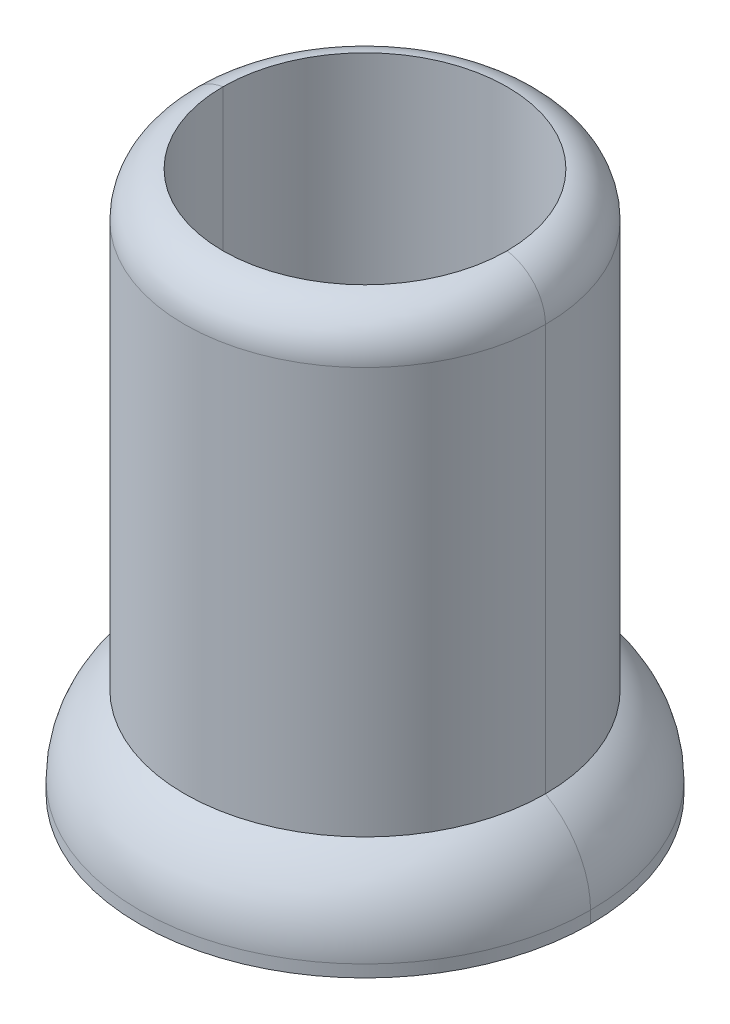
from build123d import *

# Parameters (mm, degrees)
SKETCH1_R              = 4
BOSS_EXTRUDE1_DEPTH    = 10
SKETCH6_R              = 5
BOSS_EXTRUDE2_DEPTH    = 2
SKETCH8_R              = 3.15
CUT_EXTRUDE2_DEPTH     = 14.928388277
FILLET1_R              = 2
FILLET2_R              = 1
SPLIT2_SURFACE_1_BACK  = 19.547
SPLIT2_SURFACE_1_DEPTH = 39.094
SPLIT2_SURFACE_2_BACK  = 19.547
SPLIT2_SURFACE_2_DEPTH = 39.094


with BuildPart() as part:
    # Sketch1 → Boss-Extrude1 (new body)
    with BuildSketch(Plane(origin=(0, 0, 0), x_dir=(1, 0, 0), z_dir=(0, 1, 0))):
        with Locations(Location((0, 0, 0), (0, 0, 270))):
            Circle(SKETCH1_R)
    extrude(amount=BOSS_EXTRUDE1_DEPTH)

    # Sketch6 → Boss-Extrude2 (add)
    with BuildSketch(Plane.XZ):
        with Locations(Location((0, 0, 0), (0, 0, 270))):
            Circle(SKETCH6_R)
    extrude(amount=BOSS_EXTRUDE2_DEPTH)

    # Sketch8 → Cut-Extrude2 (cut, through all)
    with BuildSketch(Plane(origin=(0, 10, 0), x_dir=(1, 0, 0), z_dir=(0, 1, 0))):
        with Locations(Location((0, 0, 0), (0, 0, 270))):
            Circle(SKETCH8_R)
    extrude(amount=-CUT_EXTRUDE2_DEPTH, mode=Mode.SUBTRACT)

    # Fillet1
    # the kernel refuses this fillet: 2 mm, written as the material it takes off along each edge
    with BuildSketch(Plane(origin=(0, 0, 0), x_dir=(0, 0, -1), z_dir=(-1, 0, 0))) as fillet1_piece_1:
        with BuildLine():
            CenterArc((3, 1.732050808), FILLET1_R, 300, 60)
            Line((4, 0), (4.02, -0.034641016))
            ThreePointArc((4.02, -0.034641016), (4.5, -0.04), (5, -0.04))
            Line((5, -0.04), (5.04, 0))
            Line((5.04, 0), (5.04, 1.732050808))
            Line((5.04, 1.732050808), (5, 1.732050808))
        make_face()
    revolve(axis=Axis((0, 0, 0), (0, -1, 0)), mode=Mode.SUBTRACT)

    # Fillet2
    # the kernel refuses this fillet: 1 mm, written as the material it takes off along each edge
    with BuildSketch(Plane(origin=(0, 10, 0), x_dir=(0, 0, 1), z_dir=(-1, 0, 0))) as fillet2_piece_1:
        with BuildLine():
            CenterArc((3, -0.988685997), FILLET2_R, 0, 81.373073441)
            Line((3.15, 0), (3.153, 0.01977372))
            ThreePointArc((3.153, 0.01977372), (3.575, 0.02), (4, 0.02))
            Line((4, 0.02), (4.02, 0))
            Line((4.02, 0), (4.02, -0.988685997))
            Line((4.02, -0.988685997), (4, -0.988685997))
        make_face()
    revolve(axis=Axis((0, 10, 0), (0, 1, 0)), mode=Mode.SUBTRACT)


with BuildPart() as body_2:
    # Split2: the piece behind the surface
    add(part.part)
    # Split2 surface: a surface, the sketch's curves swept straight by 39.094 mm
    with BuildLine(Plane(origin=(0, 10, 0), x_dir=(-1, 0, 0), z_dir=(0, -1, 0)).offset(-SPLIT2_SURFACE_1_BACK), mode=Mode.PRIVATE) as split2_surface_1_path:
        Line((-5, 0), (5, 0))
    split2_surface_1 = Shell.extrude(split2_surface_1_path.wire(), (0 * SPLIT2_SURFACE_1_DEPTH, -1 * SPLIT2_SURFACE_1_DEPTH, 0 * SPLIT2_SURFACE_1_DEPTH))
    split(bisect_by=split2_surface_1, keep=Keep.BOTTOM)


with BuildPart() as part_1:
    add(part.part)

    # Split2: split by a surface, the side it looks to stays
    # Split2 surface: a surface, the sketch's curves swept straight by 39.094 mm
    with BuildLine(Plane(origin=(0, 10, 0), x_dir=(-1, 0, 0), z_dir=(0, -1, 0)).offset(-SPLIT2_SURFACE_2_BACK), mode=Mode.PRIVATE) as split2_surface_2_path:
        Line((-5, 0), (5, 0))
    split2_surface_2 = Shell.extrude(split2_surface_2_path.wire(), (0 * SPLIT2_SURFACE_2_DEPTH, -1 * SPLIT2_SURFACE_2_DEPTH, 0 * SPLIT2_SURFACE_2_DEPTH))
    split(bisect_by=split2_surface_2, keep=Keep.TOP)


solid = Compound([body_2.part, part_1.part])
